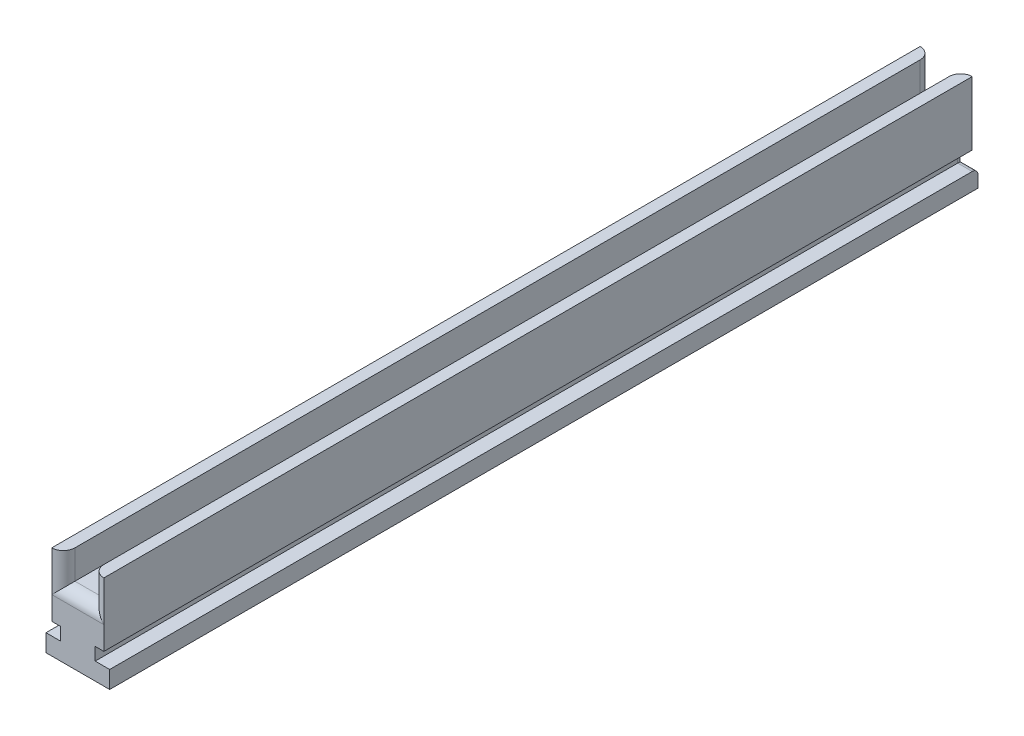
from build123d import *

# Parameters (mm, degrees)
SKETCH_1_W      = 5
SKETCH_1_H      = 6
SKETCH_1_W_2    = 6
SKETCH_1_H_2    = 2.2
EXTRUDE_1_DEPTH = 150
FILLET_1_R      = 2
FILLET_2_R      = 1


with BuildPart() as part:
    # 스케치1 → 보스-돌출1 (new body)
    with BuildSketch(Plane.XY):
        Polygon((-4.5, 0), (-3, 0), (-2.5, 0), (-2.5, 6), (-2.5, 11), (-4.5, 11), align=None)
        with Locations((0, 3)):
            Rectangle(SKETCH_1_W, SKETCH_1_H)
        Polygon((2.5, 6), (2.5, 0), (3, 0), (4.5, 0), (4.5, 11), (2.5, 11), align=None)
        with Locations((0, -1.1)):
            Rectangle(SKETCH_1_W_2, SKETCH_1_H_2)
        Polygon((3, -2.2), (-3, -2.2), (-5.5, -2.2), (-5.5, -5.2), (5.5, -5.2), (5.5, -2.2), align=None)
    extrude(amount=EXTRUDE_1_DEPTH)

    # 필렛1
    fillet_1_edges = [part.edges().sort_by_distance(p)[0] for p in [
        (-2.5, 8.5, 0),
        (2.5, 8.5, 0),
        (-2.5, 8.5, 150),
        (2.5, 8.5, 150),
        (0, 6, 0),
        (0, 6, 150),
    ]]
    fillet(fillet_1_edges, radius=FILLET_1_R - 0.0001)  # a hair under: the kernel refuses the full size

    # 필렛2
    fillet_2_edges = [part.edges().sort_by_distance(p)[0] for p in [
        (4.25, -2.2, 0),
        (-4.25, -2.2, 0),
        (-3, -1.1, 0),
        (3, -1.1, 0),
    ]]
    fillet(fillet_2_edges, radius=FILLET_2_R)


solid = part.part
